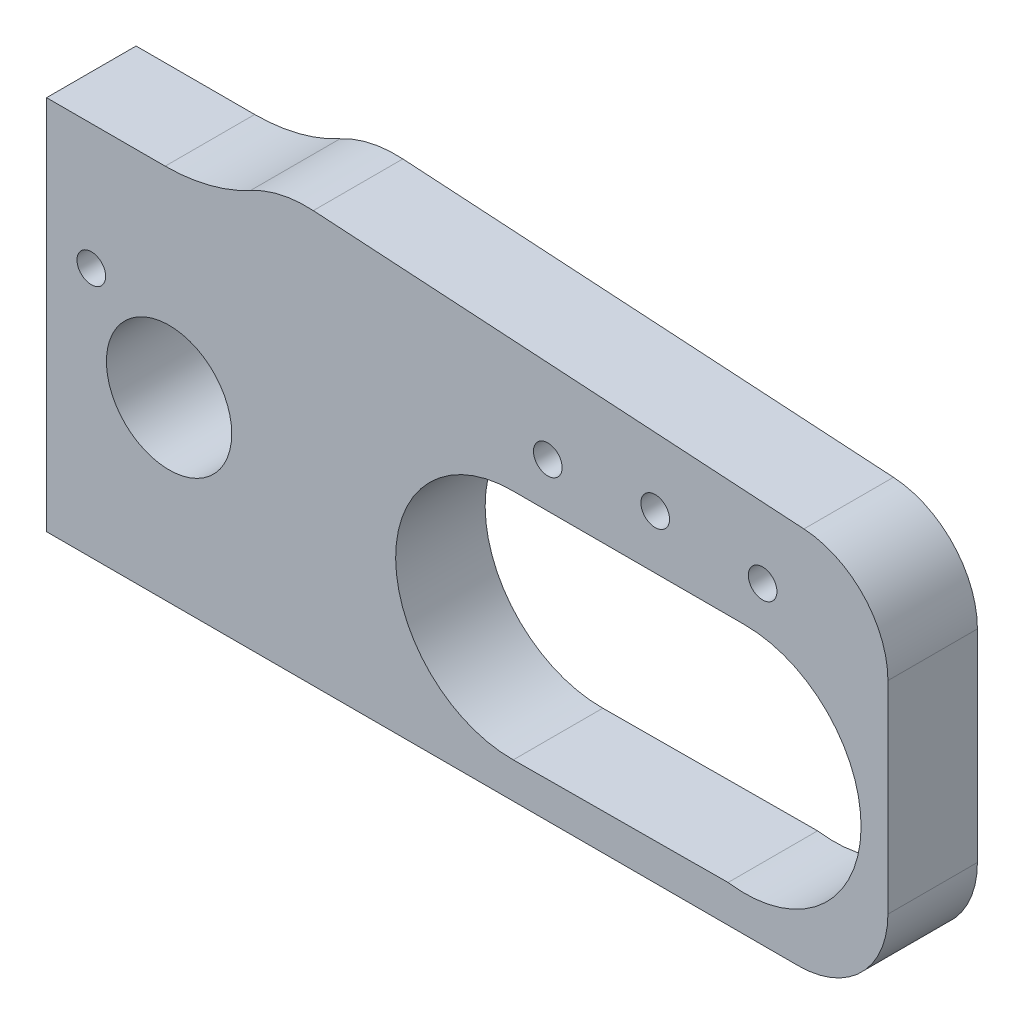
from build123d import *

# Parameters (mm, degrees)
SKETCH1_R           = 0.8
SKETCH1_R_2         = 3.5
SKETCH1_R_3         = 5.1
BOSS_EXTRUDE1_DEPTH = 5
SKETCH2_R           = 1.25
CUT_EXTRUDE1_DEPTH  = 5
BOSS_EXTRUDE2_START = -1
SKETCH21_R          = 5.1
BOSS_EXTRUDE2_DEPTH = 1


with BuildPart() as part:
    # Sketch1 → Boss-Extrude1 (new body)
    with BuildSketch(Plane(origin=(0, 0, 0), x_dir=(0, 1, 0), z_dir=(0, 0, 1))):
        with BuildLine():
            ThreePointArc((7.923715338, -23.061842121), (11.348253353, -21.704991773), (12.914157128, -18.370857874))
            Line((12.914157128, -18.370857874), (14.611258571, 9.036437401))
            ThreePointArc((14.611258571, 9.036437401), (14.470096631, 10.842810788), (13.835805455, 12.540039768))
            ThreePointArc((13.835805455, 12.540039768), (12.931450551, 14.850335933), (12.623684243, 17.312165753))
            Line((12.623684243, 17.312165753), (12.623684243, 23.938157879))
            Line((12.623684243, 23.938157879), (-8.376315757, 23.938157879))
            Line((-8.376315757, 23.938157879), (-8.376315757, -18.061842121))
            ThreePointArc((-8.376315757, -18.061842121), (-6.911849663, -21.597376027), (-3.376315757, -23.061842121))
            Line((-3.376315757, -23.061842121), (7.923715338, -23.061842121))
        make_face()
        with BuildLine():
            Line((-6.37591859, -2.133696229), (-6.376315757, -2.061842121))
            ThreePointArc((-6.376315757, -2.061842121), (0.123684243, 4.438157879), (6.623684243, -2.061842121))
            Line((6.623684243, -2.061842121), (6.623684243, -15.061842121))
            ThreePointArc((6.623684243, -15.061842121), (0.625179068, -21.542467318), (-6.298932046, -16.061842121))
            ThreePointArc((-6.298932046, -16.061842121), (-6.376216465, -15.097769724), (-6.309594086, -14.132901895))
            Line((-6.309594086, -14.132901895), (-6.37591859, -2.133696229))
        make_face(mode=Mode.SUBTRACT)
        with Locations((9.123684243, -16.061842121)):
            Circle(SKETCH1_R, mode=Mode.SUBTRACT)
        with Locations((9.623684243, -10.061842121)):
            Circle(SKETCH1_R, mode=Mode.SUBTRACT)
        with Locations((9.123684243, -4.061842121)):
            Circle(SKETCH1_R, mode=Mode.SUBTRACT)
        with Locations((1.537022692, 17.094912388)):
            Circle(SKETCH1_R_2, mode=Mode.SUBTRACT)
        with Locations((8.123684243, 9.438157879)):
            Circle(SKETCH1_R_3, mode=Mode.SUBTRACT)
        with Locations((5.623684243, 21.438157879)):
            Circle(SKETCH1_R, mode=Mode.SUBTRACT)
    extrude(amount=BOSS_EXTRUDE1_DEPTH)

    # Sketch2 → Cut-Extrude1 (cut)
    with BuildSketch(Plane(origin=(-23.938157879, 0, 0), x_dir=(0, -1, 0), z_dir=(-1, 0, 0))):
        with Locations((-9.623684243, 2.5)):
            Circle(SKETCH2_R)
        with Locations((2.876315757, 2.5)):
            Circle(SKETCH2_R)
    extrude(amount=-CUT_EXTRUDE1_DEPTH, mode=Mode.SUBTRACT)

    # Sketch21 → Boss-Extrude2 (add)
    with BuildSketch(Plane.XY.offset(5).offset(BOSS_EXTRUDE2_START)):
        with Locations((-9.438157879, 8.123684243)):
            Circle(SKETCH21_R)
    extrude(amount=BOSS_EXTRUDE2_DEPTH)


solid = part.part
